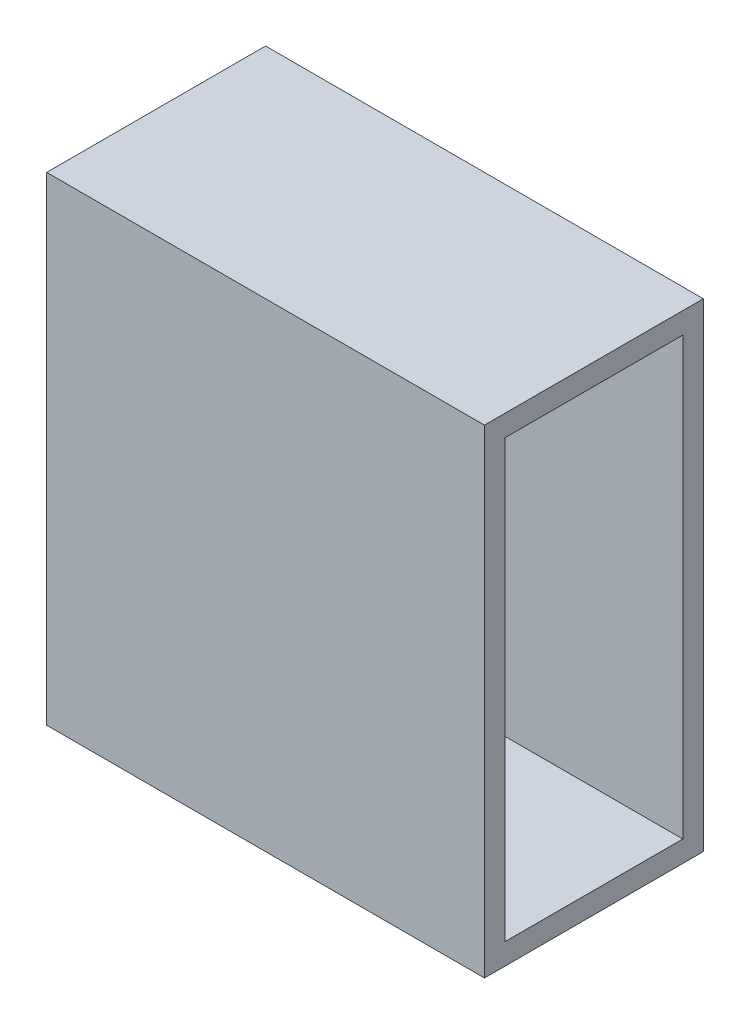
from build123d import *

# Parameters (mm, degrees)
SKETCH1_W           = 35
SKETCH1_H           = 16
BOSS_EXTRUDE1_DEPTH = 26
SKETCH1_3_W         = 4.2
SKETCH1_3_H         = 13
BOSS_EXTRUDE2_DEPTH = 2
SKETCH3_W           = 35
SKETCH3_H           = 16
SKETCH3_W_2         = 31.9
SKETCH3_H_2         = 13
BOSS_EXTRUDE4_DEPTH = 4.5
SKETCH5_W           = 35
SKETCH5_H           = 16
SKETCH5_R           = 5.2
BOSS_EXTRUDE5_DEPTH = 1.5


with BuildPart() as part:
    # Sketch1 → Boss-Extrude1 (new body)
    with BuildSketch(Plane.YZ):
        with Locations((-17.5, 8)):
            Rectangle(SKETCH1_W, SKETCH1_H)
        Polygon((-33.45, 14.5), (-29.25, 14.5), (-5.75, 14.5), (-1.55, 14.5), (-1.55, 1.5), (-5.75, 1.5), (-29.25, 1.5), (-33.45, 1.5), align=None, mode=Mode.SUBTRACT)
    extrude(amount=BOSS_EXTRUDE1_DEPTH)

    # Sketch1<3> → Boss-Extrude2 (add)
    with BuildSketch(Plane.YZ):
        with Locations((-31.35, 8)):
            Rectangle(SKETCH1_3_W, SKETCH1_3_H)
        with Locations((-3.65, 8)):
            Rectangle(SKETCH1_3_W, SKETCH1_3_H)
    extrude(amount=BOSS_EXTRUDE2_DEPTH)

    # Sketch3 → Boss-Extrude4 (add)
    with BuildSketch(Plane(origin=(0, 0, 0), x_dir=(0, -1, 0), z_dir=(-1, 0, 0))):
        with Locations((17.5, 8)):
            Rectangle(SKETCH3_W, SKETCH3_H)
        with Locations((17.5, 8)):
            Rectangle(SKETCH3_W_2, SKETCH3_H_2, mode=Mode.SUBTRACT)
    extrude(amount=BOSS_EXTRUDE4_DEPTH)

    # Sketch5 → Boss-Extrude5 (add)
    with BuildSketch(Plane(origin=(-4.5, 0, 0), x_dir=(0, -1, 0), z_dir=(-1, 0, 0))):
        with Locations((17.5, 8)):
            Rectangle(SKETCH5_W, SKETCH5_H)
        with Locations((22.25, 8)):
            Circle(SKETCH5_R, mode=Mode.SUBTRACT)
    extrude(amount=BOSS_EXTRUDE5_DEPTH)


solid = part.part
